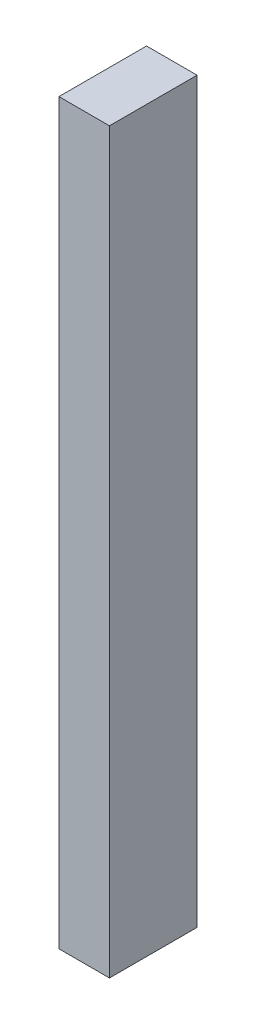
from build123d import *

# Parameters (mm, degrees)
SKETCH_1_W      = 3
SKETCH_1_H      = 43.8
EXTRUDE_1_DEPTH = 5.2


with BuildPart() as part:
    # 草圖1 → 填料-伸長1 (new body)
    with BuildSketch(Plane.XY):
        Rectangle(SKETCH_1_W, SKETCH_1_H)
    extrude(amount=EXTRUDE_1_DEPTH)


solid = part.part
